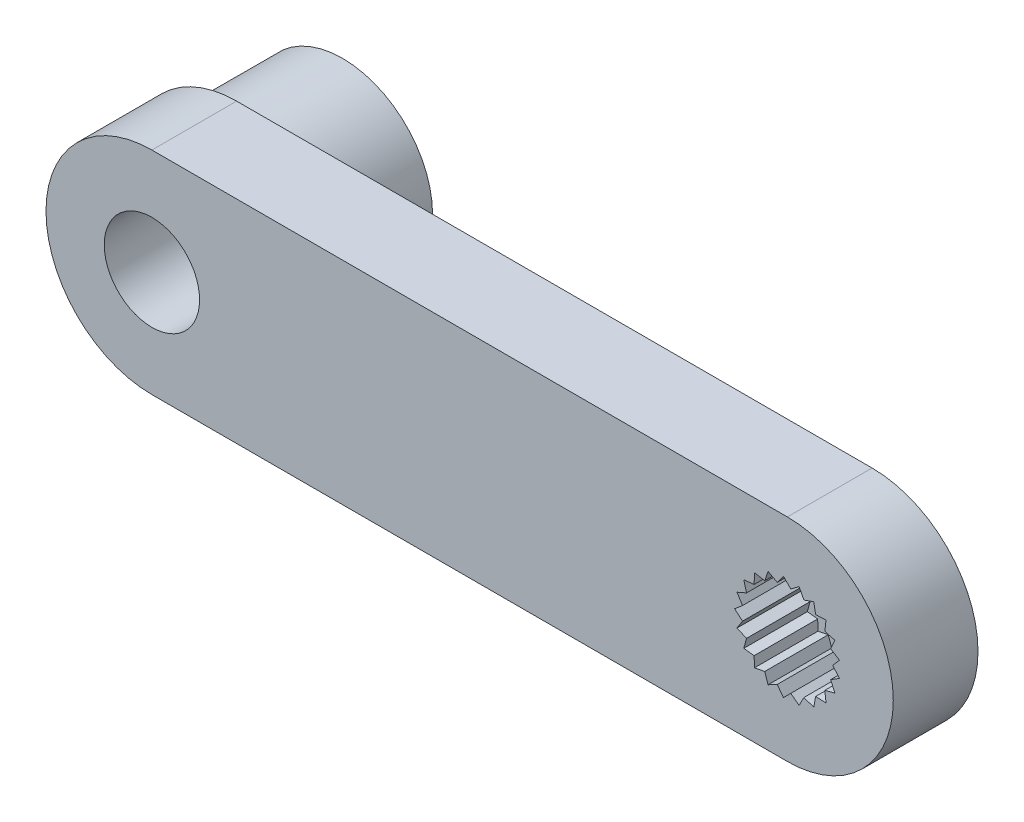
from build123d import *
from build123d.topology import SkipClean

# Parameters (mm, degrees)
SKETCH1_R           = 2.25
SKETCH1_R_2         = 1
BOSS_EXTRUDE1_DEPTH = 2
SKETCH2_R           = 2.49
CUT_EXTRUDE1_DEPTH  = 3
BOSS_EXTRUDE2_START = 1
SKETCH3_R           = 3
SKETCH3_R_2         = 1
BOSS_EXTRUDE2_DEPTH = 1
BOSS_EXTRUDE3_START = 5
SKETCH4_R           = 4.25
SKETCH4_R_2         = 2.25
BOSS_EXTRUDE3_DEPTH = 5
BOSS_EXTRUDE4_DEPTH = 3.2
CIRPATTERN2_COUNT   = 21


with BuildPart() as part:
    # Sketch1 → Boss-Extrude1 (new, symmetric)
    with BuildSketch(Plane.XY):
        with BuildLine():
            Line((0, 5), (30, 5))
            ThreePointArc((30, 5), (35, 0), (30, -5))
            Line((30, -5), (0, -5))
            ThreePointArc((0, -5), (-5, 0), (0, 5))
        make_face()
        Circle(SKETCH1_R, mode=Mode.SUBTRACT)
        with Locations((30, 0)):
            Circle(SKETCH1_R_2, mode=Mode.SUBTRACT)
    extrude(amount=BOSS_EXTRUDE1_DEPTH, both=True)

    # Sketch2 → Cut-Extrude1 (cut)
    with BuildSketch(Plane.XY.offset(2)):
        with Locations((30, 0)):
            Circle(SKETCH2_R)
    extrude(amount=-CUT_EXTRUDE1_DEPTH, mode=Mode.SUBTRACT)

    # Sketch3 → Boss-Extrude2 (add)
    with BuildSketch(Plane(origin=(0, 0, -2), x_dir=(-1, 0, 0), z_dir=(0, 0, -1)).offset(BOSS_EXTRUDE2_START)):
        with Locations((-30, 0)):
            Circle(SKETCH3_R)
        with Locations((-30, 0)):
            Circle(SKETCH3_R_2, mode=Mode.SUBTRACT)
    extrude(amount=-BOSS_EXTRUDE2_DEPTH)

    # Sketch4 → Boss-Extrude3 (add)
    with SkipClean():  # the faces are left unmerged after this step: merging them gives an invalid solid
        with BuildSketch(Plane(origin=(0, 0, -2), x_dir=(-1, 0, 0), z_dir=(0, 0, -1)).offset(BOSS_EXTRUDE3_START)):
            Circle(SKETCH4_R)
            Circle(SKETCH4_R_2, mode=Mode.SUBTRACT)
        extrude(amount=-BOSS_EXTRUDE3_DEPTH)

    # Sketch5 → Boss-Extrude4 (add)
    with SkipClean():  # the faces are left unmerged after this step: merging them gives an invalid solid
        with BuildSketch(Plane.XY.offset(2)):
            with BuildLine():
                Line((32.462188757, 0.371115243), (32.14, 0))
                Line((32.14, 0), (32.462188757, -0.371115243))
                ThreePointArc((32.462188757, -0.371115243), (32.49, 0), (32.462188757, 0.371115243))
            make_face()
        boss_extrude4 = extrude(amount=-BOSS_EXTRUDE4_DEPTH)

    # CirPattern2: Boss-Extrude4 ×21 about axis
    with SkipClean():  # the faces are left unmerged after this step: merging them gives an invalid solid
        cirpattern2_axis = Axis((30, 0, -1), (0, 0, 1))
        for i in range(1, CIRPATTERN2_COUNT):
            add(boss_extrude4.rotate(cirpattern2_axis, i * 360 / CIRPATTERN2_COUNT))


solid = part.part
